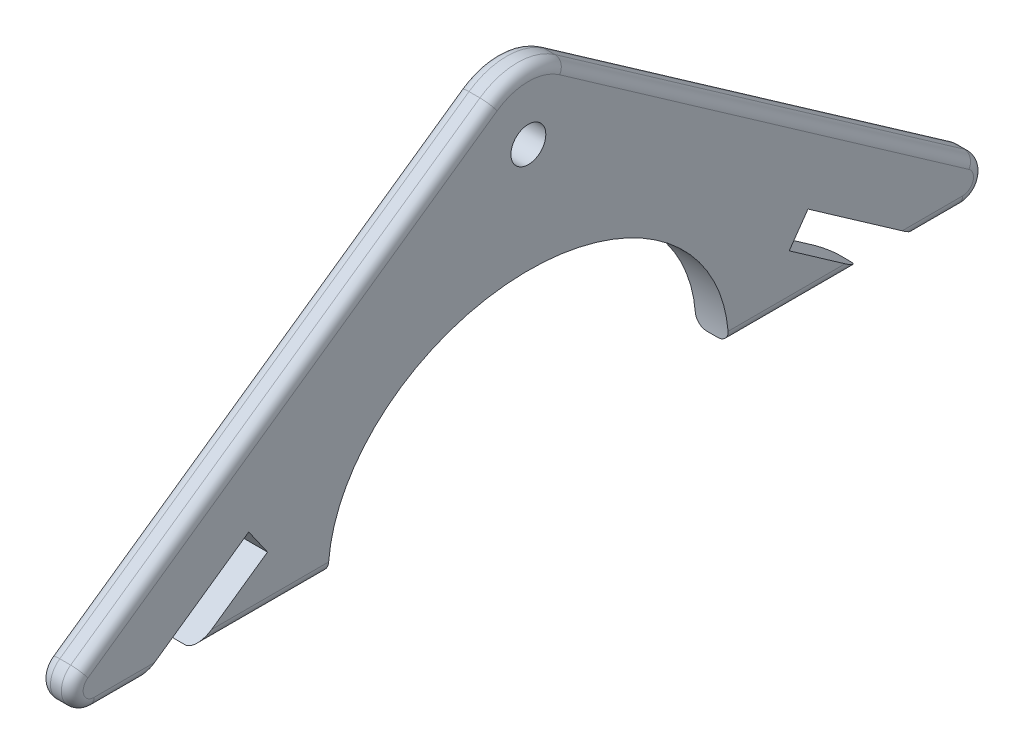
from build123d import *

# Parameters (mm, degrees)
SKETCH1_R           = 1.6
BOSS_EXTRUDE1_DEPTH = 3
FILLET1_R           = 1


with BuildPart() as part:
    # Sketch1 → Boss-Extrude1 (new body)
    with BuildSketch(Plane(origin=(0, 0, 0), x_dir=(0, 0, -1), z_dir=(1, 0, 0))):
        with BuildLine():
            Line((-3.441458618, 4.914912266), (-40.96834421, -21.361695911))
            ThreePointArc((-40.96834421, -21.361695911), (-41.728625239, -23.601411599), (-39.821191338, -25))
            Line((-39.821191338, -25), (-35.703700169, -25))
            Line((-35.703700169, -25), (-25.640872736, -17.953932376))
            Line((-25.640872736, -17.953932376), (-23.920143427, -20.411388509))
            Line((-23.920143427, -20.411388509), (-30.473359782, -25))
            Line((-30.473359782, -25), (-18.353403054, -25))
            add(Edge.make_bspline(
                [(18.353403054, -25), (18.353403054, -10), (0, -10), (-18.353403054, -10), (-18.353403054, -25)],
                knots=[3.141592654, 3.141592654, 3.141592654, 4.71238898, 4.71238898, 6.283185307, 6.283185307, 6.283185307], degree=2, weights=[1, 0.707106781, 1, 0.707106781, 1]))
            Line((18.353403054, -25), (30.473359782, -25))
            Line((30.473359782, -25), (23.920143427, -20.411388509))
            Line((23.920143427, -20.411388509), (25.640872736, -17.953932376))
            Line((25.640872736, -17.953932376), (35.703700169, -25))
            Line((35.703700169, -25), (39.821191338, -25))
            ThreePointArc((39.821191338, -25), (41.728625239, -23.601411599), (40.96834421, -21.361695911))
            Line((40.96834421, -21.361695911), (3.441458618, 4.914912266))
            ThreePointArc((3.441458618, 4.914912266), (0, 6), (-3.441458618, 4.914912266))
        make_face()
        Circle(SKETCH1_R, mode=Mode.SUBTRACT)
    extrude(amount=BOSS_EXTRUDE1_DEPTH)

    # Fillet1
    fillet1_edges = [part.edges().sort_by_distance(p)[0] for p in [
        (0, -25, -37.762445753),
        (0, -8.223391823, -22.204901414),
        (0, 6, 0),
        (0, -25, 37.762445753),
        (3, -25, -37.762445753),
        (3, -8.223391823, -22.204901414),
        (3, 6, 0),
        (3, -25, 37.762445753),
        (0, -25, -24.413381418),
        (3, -25, -24.413381418),
        (0, -25, 24.413381418),
        (3, -25, 24.413381418),
        (0, -8.223391823, 22.204901414),
        (3, -8.223391823, 22.204901414),
        (0, -23.601411599, -41.728625239),
        (0, -23.601411599, 41.728625239),
        (3, -23.601411599, -41.728625239),
        (3, -23.601411599, 41.728625239),
    ]]
    fillet(fillet1_edges, radius=FILLET1_R)


solid = part.part
